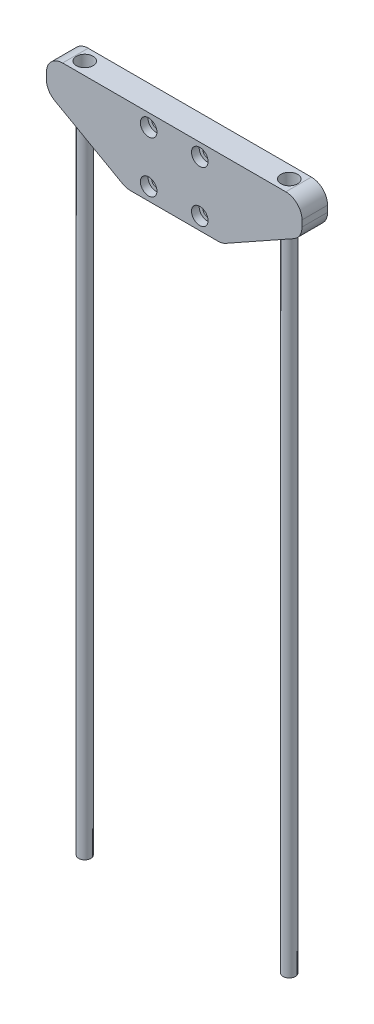
from build123d import *

# Parameters (mm, degrees)
BOSS_EXTRUDE1_DEPTH            = 5
CUT_EXTRUDE1_DEPTH             = 10
SKETCH4_W                      = 2.38125
SKETCH4_H                      = 254
SKETCH4_3_W                    = 2.38125
SKETCH4_3_H                    = 254
CBORE_FOR_M3_SHCS1_AT_2_COUNT  = 2
CBORE_FOR_M3_SHCS1_AT_2_PITCH  = 20
CBORE_FOR_M3_SHCS1_AT_3_COUNT  = 2
CBORE_FOR_M3_SHCS1_AT_3_PITCH  = 28.284271247
CBORE_FOR_M3_SHCS1_AT_4_COUNT  = 2
CBORE_FOR_M3_SHCS1_AT_4_PITCH  = 20
CBORE_FOR_M3_SHCS2_AT_2_COUNT  = 2
CBORE_FOR_M3_SHCS2_AT_2_PITCH  = 80
M3X0_5_TAPPED_HOLE1_AT_2_COUNT = 2
M3X0_5_TAPPED_HOLE1_AT_2_PITCH = 80
FILLET1_R                      = 6.35


with BuildPart() as part:
    # Sketch3 → Boss-Extrude1 (new, symmetric)
    with BuildSketch(Plane.XY):
        Polygon((-50, 15), (-50, 2.5), (-18.75, -15), (18.75, -15), (50, 2.5), (50, 15), align=None)
    extrude(amount=BOSS_EXTRUDE1_DEPTH, both=True)

    # Sketch10 → Cut-Extrude1 (cut)
    with BuildSketch(Plane(origin=(0, 0, 0), x_dir=(1, 0, 0), z_dir=(0, 1, 0))):
        with BuildLine():
            Line((40, 2.38125), (35, 2.38125))
            ThreePointArc((35, 2.38125), (32.61875, 0), (35, -2.38125))
            Line((35, -2.38125), (40, -2.38125))
            ThreePointArc((40, -2.38125), (42.38125, 0), (40, 2.38125))
        make_face()
        with BuildLine():
            Line((-40, 2.38125), (-35, 2.38125))
            ThreePointArc((-35, 2.38125), (-32.61875, 0), (-35, -2.38125))
            Line((-35, -2.38125), (-40, -2.38125))
            ThreePointArc((-40, -2.38125), (-42.38125, 0), (-40, 2.38125))
        make_face()
    extrude(amount=-CUT_EXTRUDE1_DEPTH, mode=Mode.SUBTRACT)

    # Sketch6 → CBORE for M3 SHCS1 (revolve, cut)
    with BuildSketch(Plane(origin=(-10, 10, 5), x_dir=(0, -1, 0), z_dir=(1, 0, 0))):
        Polygon((0, 0), (0, 8.581549114), (1.8, 7.5), (1.8, 3), (3.25, 3), (3.25, 0), align=None)
    cbore_for_m3_shcs1 = revolve(axis=Axis((-10, 10, 11.35), (0, 0, -1)), mode=Mode.SUBTRACT)

    # CBORE for M3 SHCS1 at 2: CBORE for M3 SHCS1 ×2
    with Locations(*[(0, -i * CBORE_FOR_M3_SHCS1_AT_2_PITCH, 0) for i in range(1, CBORE_FOR_M3_SHCS1_AT_2_COUNT)]):
        add(cbore_for_m3_shcs1, mode=Mode.SUBTRACT)

    # CBORE for M3 SHCS1 at 3: CBORE for M3 SHCS1 ×2
    with Locations(*[Vector(0.7071067811865485, -0.7071067811865467, 0) * (i * CBORE_FOR_M3_SHCS1_AT_3_PITCH) for i in range(1, CBORE_FOR_M3_SHCS1_AT_3_COUNT)]):
        add(cbore_for_m3_shcs1, mode=Mode.SUBTRACT)

    # CBORE for M3 SHCS1 at 4: CBORE for M3 SHCS1 ×2
    with Locations(*[(i * CBORE_FOR_M3_SHCS1_AT_4_PITCH, 0, 0) for i in range(1, CBORE_FOR_M3_SHCS1_AT_4_COUNT)]):
        add(cbore_for_m3_shcs1, mode=Mode.SUBTRACT)

    # Sketch12 → CBORE for M3 SHCS2 (revolve, cut)
    with BuildSketch(Plane(origin=(-40, 15, 0), x_dir=(0, 0, 1), z_dir=(1, 0, 0))):
        Polygon((0, 0), (0, 269), (1.8, 269), (1.8, 11), (3.25, 11), (3.25, 0), align=None)
    cbore_for_m3_shcs2 = revolve(axis=Axis((-40, 21.35, 0), (0, -1, 0)), mode=Mode.SUBTRACT)

    # CBORE for M3 SHCS2 at 2: CBORE for M3 SHCS2 ×2
    with Locations(*[(i * CBORE_FOR_M3_SHCS2_AT_2_PITCH, 0, 0) for i in range(1, CBORE_FOR_M3_SHCS2_AT_2_COUNT)]):
        add(cbore_for_m3_shcs2, mode=Mode.SUBTRACT)

    # Fillet1
    fillet1_edges = [part.edges().sort_by_distance(p)[0] for p in [
        (-18.75, -15, 0),
        (18.75, -15, 0),
        (50, 2.5, 0),
        (50, 15, 0),
        (-50, 15, 0),
        (-50, 2.5, 0),
    ]]
    fillet(fillet1_edges, radius=FILLET1_R)


with BuildPart() as body_2:
    # Sketch4 → Revolve1 (revolve)
    with BuildSketch(Plane.XY):
        with Locations((-41.190625, -127)):
            Rectangle(SKETCH4_W, SKETCH4_H)
    revolve(axis=Axis((-40, -254, 0), (0, -1, 0)))

    # Sketch14 → M3x0.5 Tapped Hole1 (revolve, cut)
    with BuildSketch(Plane(origin=(-40, 0, 0), x_dir=(0, 0, 1), z_dir=(1, 0, 0))):
        Polygon((0, 0), (0, 8.251075774), (1.25, 7.5), (1.25, 0), align=None)
    m3x0_5_tapped_hole1 = revolve(axis=Axis((-40, 6.35, 0), (0, -1, 0)), mode=Mode.SUBTRACT)


with BuildPart() as body_3:
    # Sketch4<3> → Revolve2 (revolve)
    with BuildSketch(Plane.XY):
        with Locations((38.809375, -127)):
            Rectangle(SKETCH4_3_W, SKETCH4_3_H)
    revolve(axis=Axis((40, -254, 0), (0, -1, 0)))

    # M3x0.5 Tapped Hole1 at 2: M3x0.5 Tapped Hole1 ×2
    with Locations(*[(i * M3X0_5_TAPPED_HOLE1_AT_2_PITCH, 0, 0) for i in range(1, M3X0_5_TAPPED_HOLE1_AT_2_COUNT)]):
        add(m3x0_5_tapped_hole1, mode=Mode.SUBTRACT)


solid = Compound([part.part, body_2.part, body_3.part])
